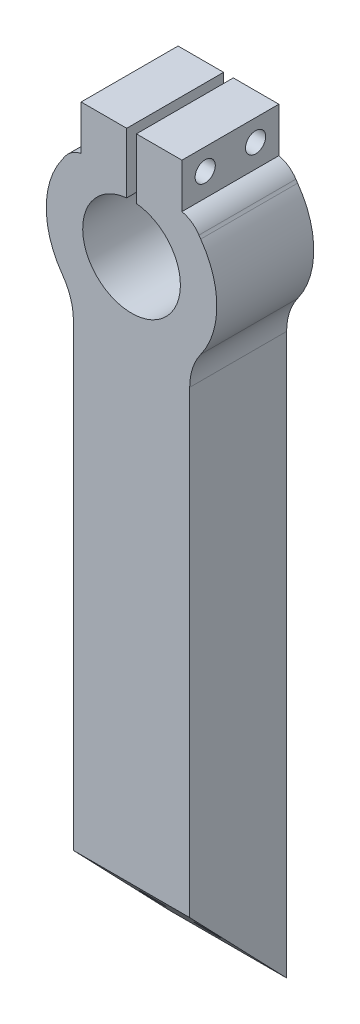
from build123d import *

# Parameters (mm, degrees)
BOSS_EXTRUDE1_DEPTH      = 25
CUT_EXTRUDE2_DEPTH       = 194.321380264
SKETCH4_R                = 6.25
CUT_EXTRUDE5_DEPTH       = 3.5
SKETCH5_R                = 2.55
CUT_EXTRUDE6_DEPTH       = 194.321380264
SKETCH6_R                = 12.6
CUT_EXTRUDE7_DEPTH       = 194.321380264
SKETCH8_W                = 30
SKETCH8_H                = 12
BOSS_EXTRUDE2_DEPTH      = 25
FILLET1_R                = 15
FILLET2_R                = 2
CUT_EXTRUDE8_DEPTH       = 200.255045248
CUT_EXTRUDE8_DEPTH_BACK  = 200.255045248
SKETCH9_R                = 2.6
CUT_EXTRUDE9_START       = 2
SKETCH10_W               = 25
SKETCH10_H               = 16.5
CUT_EXTRUDE9_DEPTH       = 25
CUT_EXTRUDE10_START      = 28
SKETCH11_W               = 25
SKETCH11_H               = 16.5
CUT_EXTRUDE10_DEPTH      = 25
CUT_EXTRUDE11_DEPTH      = 200.255045248
CUT_EXTRUDE11_DEPTH_BACK = 200.255045248
SKETCH13_W               = 2.5
SKETCH13_H               = 16
FILLET6_R                = 7


with BuildPart() as part:
    # Sketch1 → Boss-Extrude1 (new body)
    with BuildSketch(Plane.XY):
        with BuildLine():
            Line((0, 0), (30, 0))
            Line((30, 0), (30, 150))
            ThreePointArc((30, 150), (15, 188.093476939), (0, 150))
            Line((0, 150), (0, 0))
        make_face()
    extrude(amount=BOSS_EXTRUDE1_DEPTH)

    # Sketch2 → Cut-Extrude2 (cut, through all)
    with BuildSketch(Plane(origin=(0, 0, 0), x_dir=(0, 0, -1), z_dir=(1, 0, 0))):
        Polygon((0, 0), (-25, 26), (-25, 0), align=None)
    extrude(amount=CUT_EXTRUDE2_DEPTH, mode=Mode.SUBTRACT)

    # Sketch4 → Cut-Extrude5 (cut)
    with BuildSketch(Plane.XY):
        with Locations((8, 13)):
            Circle(SKETCH4_R)
        with Locations((22, 13)):
            Circle(SKETCH4_R)
    extrude(amount=CUT_EXTRUDE5_DEPTH, mode=Mode.SUBTRACT)

    # Sketch5 → Cut-Extrude6 (cut, through all)
    with BuildSketch(Plane.XY):
        with Locations(Location((8, 13, 0), (0, 0, 270))):
            Circle(SKETCH5_R)
        with Locations(Location((22, 13, 0), (0, 0, 270))):
            Circle(SKETCH5_R)
    extrude(amount=CUT_EXTRUDE6_DEPTH, mode=Mode.SUBTRACT)

    # Sketch6 → Cut-Extrude7 (cut, through all)
    with BuildSketch(Plane.XY):
        with Locations((15, 166.093476939)):
            Circle(SKETCH6_R)
    extrude(amount=CUT_EXTRUDE7_DEPTH, mode=Mode.SUBTRACT)

    # Sketch8 → Boss-Extrude2 (add)
    with BuildSketch(Plane.XY):
        with Locations((15, 188.186953879)):
            Rectangle(SKETCH8_W, SKETCH8_H)
    extrude(amount=BOSS_EXTRUDE2_DEPTH)

    # Fillet1
    fillet1_edges = [part.edges().sort_by_distance(p)[0] for p in [
        (0, 182.186953879, 12.5),
        (30, 182.186953879, 12.5),
        (0, 150, 12.5),
        (30, 150, 12.5),
    ]]
    fillet(fillet1_edges, radius=FILLET1_R)

    # Fillet2
    fillet2_edges = [part.edges().sort_by_distance(p)[0] for p in [
        (0, 194.186953879, 12.5),
        (30, 194.186953879, 12.5),
    ]]
    fillet(fillet2_edges, radius=FILLET2_R)

    # Sketch9 → Cut-Extrude8 (cut, two sides: drawn at the far end of the back side and taken through both)
    with BuildSketch(Plane(origin=(0, 0, 0), x_dir=(0, 0, -1), z_dir=(1, 0, 0)).offset(-CUT_EXTRUDE8_DEPTH_BACK)):
        with Locations(Location((-6, 188.686953879, 0), (0, 0, 201.12545117))):
            Circle(SKETCH9_R)
        with Locations(Location((-19, 188.686953879, 0), (0, 0, 201.12545117))):
            Circle(SKETCH9_R)
    extrude(amount=CUT_EXTRUDE8_DEPTH + CUT_EXTRUDE8_DEPTH_BACK, mode=Mode.SUBTRACT)

    # Sketch10 → Cut-Extrude9 (cut)
    with BuildSketch(Plane(origin=(0, 0, 0), x_dir=(0, 0, -1), z_dir=(1, 0, 0)).offset(CUT_EXTRUDE9_START)):
        with Locations((-12.5, 190.936953879)):
            Rectangle(SKETCH10_W, SKETCH10_H)
    extrude(amount=-CUT_EXTRUDE9_DEPTH, mode=Mode.SUBTRACT)

    # Sketch11 → Cut-Extrude10 (cut)
    with BuildSketch(Plane(origin=(0, 0, 0), x_dir=(0, 0, -1), z_dir=(1, 0, 0)).offset(CUT_EXTRUDE10_START)):
        with Locations((-12.5, 190.936953879)):
            Rectangle(SKETCH11_W, SKETCH11_H)
    extrude(amount=CUT_EXTRUDE10_DEPTH, mode=Mode.SUBTRACT)

    # Sketch13 → Cut-Extrude11 (cut, two sides: drawn at the far end of the back side and taken through both)
    with BuildSketch(Plane.XY.offset(-CUT_EXTRUDE11_DEPTH_BACK)):
        with Locations((15, 186.186953879)):
            Rectangle(SKETCH13_W, SKETCH13_H)
    extrude(amount=CUT_EXTRUDE11_DEPTH + CUT_EXTRUDE11_DEPTH_BACK, mode=Mode.SUBTRACT)

    # Fillet6
    # the kernel refuses this fillet: 7 mm, written as the material it takes off along each edge
    with BuildSketch(Plane(origin=(30.880271574, 182.686953879, -8.501523298), x_dir=(-1, 0, 0), z_dir=(0, 0, 1))) as fillet6_piece_1:
        with BuildLine():
            CenterArc((4.384431788, 6.836483164), FILLET6_R, 212.743731737, 44.847779206)
            Line((-1.503255553, 3.050305966), (-1.6210093, 2.974582422))
            ThreePointArc((-1.6210093, 2.974582422), (-0.790485812, 1.506002918), (-0.131784132, -0.047254022))
            Line((-0.131784132, -0.047254022), (0, -0.14))
            ThreePointArc((0, -0.14), (1.440135787, -0.14), (2.85018837, -0.136729663))
            Line((2.85018837, -0.136729663), (2.880271574, 0))
        make_face()
    extrude(amount=42.003046595, mode=Mode.SUBTRACT)
    with BuildSketch(Plane(origin=(-0.880271574, 182.686953879, -8.501523298), x_dir=(-0.44205476486446993, -0.8969880628306143, 0), z_dir=(0, 0, 1))) as fillet6_piece_2:
        with BuildLine():
            CenterArc((4.194084827, 6.954882933), FILLET6_R, 218.64354594, 44.847779206)
            Line((-1.273237773, 2.58356922), (-1.382584225, 2.496142945))
            ThreePointArc((-1.382584225, 2.496142945), (-0.762197216, 1.229896943), (-0.125578329, -0.061887667))
            Line((-0.125578329, -0.061887667), (0.01586951, -0.139097659))
            ThreePointArc((0.01586951, -0.139097659), (1.70030466, -0.043320572), (3.384739809, -0.139097659))
            Line((3.384739809, -0.139097659), (3.400609319, 0))
        make_face()
    extrude(amount=42.003046595, mode=Mode.SUBTRACT)


solid = part.part
